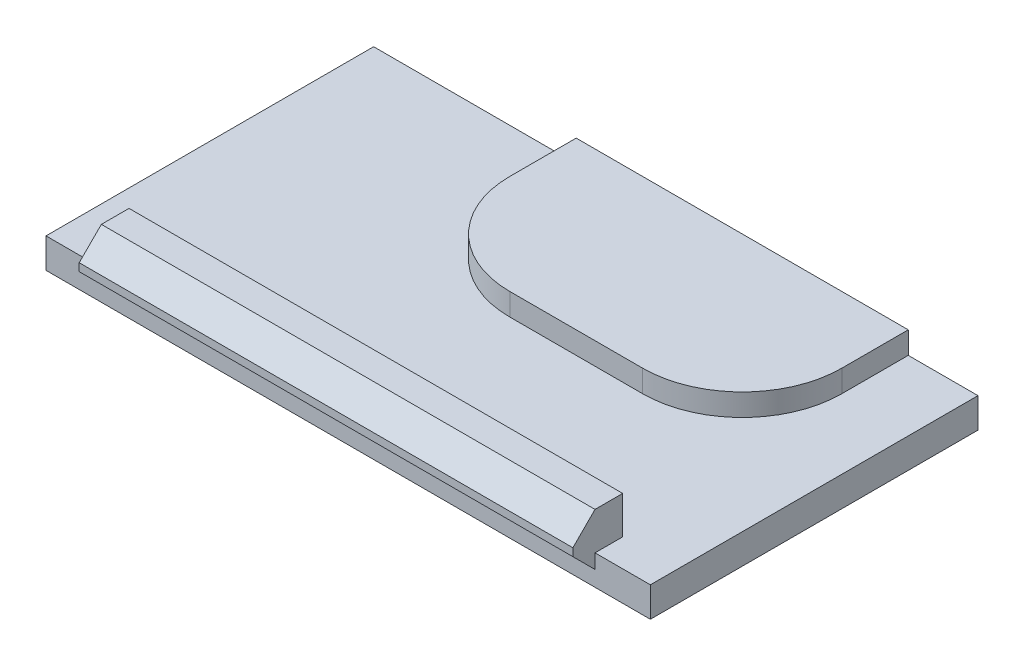
from build123d import *

# Parameters (mm, degrees)
SKETCH1_W           = 69.342
SKETCH1_H           = 37.592
BOSS_EXTRUDE1_DEPTH = 3.429
CUT_EXTRUDE1_DEPTH  = 3.429
SKETCH5_W           = 56.642
SKETCH5_H           = 6.35
BOSS_EXTRUDE3_DEPTH = 2.54
CHAMFER1_SIZE       = 2.7305
SKETCH6_W           = 56.642
SKETCH6_H           = 4.318
BOSS_EXTRUDE4_DEPTH = 3.175
CUT_EXTRUDE2_DEPTH  = 1.016
BOSS_EXTRUDE5_DEPTH = 2.54
CUT_EXTRUDE3_DEPTH  = 0.635


with BuildPart() as part:
    # Sketch1 → Boss-Extrude1 (new body)
    with BuildSketch(Plane(origin=(0, 0, 0), x_dir=(1, 0, 0), z_dir=(0, 1, 0))):
        with Locations((34.671, 18.796)):
            Rectangle(SKETCH1_W, SKETCH1_H)
    extrude(amount=BOSS_EXTRUDE1_DEPTH)

    # Sketch3 → Cut-Extrude1 (cut)
    with BuildSketch(Plane.XZ):
        with BuildLine():
            Line((34.671, -22.352), (49.911, -22.352))
            ThreePointArc((49.911, -22.352), (55.299153673, -24.583846327), (57.531, -29.972))
            Line((57.531, -29.972), (57.531, -37.592))
            Line((57.531, -37.592), (27.051, -37.592))
            Line((27.051, -37.592), (27.051, -29.972))
            ThreePointArc((27.051, -29.972), (29.282846327, -24.583846327), (34.671, -22.352))
        make_face()
    extrude(amount=-CUT_EXTRUDE1_DEPTH, mode=Mode.SUBTRACT)

    # Sketch5 → Boss-Extrude3 (add)
    with BuildSketch(Plane.XY):
        with Locations((34.671, 4.7625)):
            Rectangle(SKETCH5_W, SKETCH5_H)
    extrude(amount=BOSS_EXTRUDE3_DEPTH)

    # Chamfer1
    # the kernel refuses this chamfer: 2.7305 mm, written as the material it takes off along each edge
    with BuildSketch(Plane(origin=(-0.671980399, 1.5875, 2.54), x_dir=(0, -0.02749587661058634, -0.9996219169112968), z_dir=(1, 0, 0))) as chamfer1_piece_1_section:
        Polygon((CHAMFER1_SIZE * 0.999621916911, CHAMFER1_SIZE * 0.0274958766106), (-CHAMFER1_SIZE * 0.0274958766106, CHAMFER1_SIZE * 0.999621916911), (0, 0), align=None)
    chamfer1_piece_1 = extrude(amount=70.685960797, mode=Mode.PRIVATE)
    chamfer1_piece_1 = split(chamfer1_piece_1, bisect_by=Plane(origin=(34.671, 2.498762028, 0), z_dir=(0, 0, 1)), keep=Keep.TOP, mode=Mode.PRIVATE)
    add(chamfer1_piece_1, mode=Mode.SUBTRACT)
    with BuildSketch(Plane(origin=(70.013980399, 7.9375, 2.54), x_dir=(0, 0.02749587661058634, -0.9996219169112968), z_dir=(-1, 0, 0))) as chamfer1_piece_2:
        Polygon((CHAMFER1_SIZE * 0.999621916911, CHAMFER1_SIZE * 0.0274958766106), (-CHAMFER1_SIZE * 0.0274958766106, CHAMFER1_SIZE * 0.999621916911), (0, 0), align=None)
    extrude(amount=70.685960797, mode=Mode.SUBTRACT)

    # Sketch6 → Boss-Extrude4 (add)
    with BuildSketch(Plane(origin=(0, 0, 0), x_dir=(-1, 0, 0), z_dir=(0, 0, -1))):
        with Locations((-34.671, 5.588)):
            Rectangle(SKETCH6_W, SKETCH6_H)
    extrude(amount=BOSS_EXTRUDE4_DEPTH)

    # Sketch7 → Cut-Extrude2 (cut)
    # profile 1 of 7: a face of its own
    with BuildSketch(Plane.XZ):
        with BuildLine():
            Line((17.8435, -9.756179687), (17.8435, -11.630173828))
            Line((17.8435, -11.630173828), (19.303255859, -13.87871875))
            add(Edge.make_bspline(
                [(19.303255859, -13.87871875), (19.333082521, -13.92746022), (19.389220216, -14.01919807), (19.467229222, -14.148781061), (19.528677409, -14.264558967), (19.580016227, -14.365273157), (19.61965403, -14.455605764), (19.647893884, -14.540082133), (19.664806725, -14.620103968), (19.666892598, -14.672398842), (19.667884766, -14.697273437)],
                knots=[0, 0, 0, 0, 1.513765201, 2.849104966, 4.005400528, 4.984881254, 5.843325008, 6.615578944, 7.341485849, 8, 8, 8, 8], degree=3))
            add(Edge.make_bspline(
                [(19.667884766, -14.697273437), (19.666083256, -14.736461594), (19.662532201, -14.81370753), (19.623568591, -14.924079539), (19.564613316, -15.026549808), (19.482815159, -15.116813938), (19.385320142, -15.192772997), (19.274562965, -15.248141814), (19.153012492, -15.281347879), (19.06864655, -15.285499159), (19.025443359, -15.287625)],
                knots=[0, 0, 0, 0, 0.967290349, 1.906679347, 2.865963496, 3.881670404, 4.904070167, 5.91189522, 6.930696602, 8, 8, 8, 8], degree=3))
            add(Edge.make_bspline(
                [(19.025443359, -15.287625), (18.971900024, -15.285744756), (18.871555299, -15.282221021), (18.732350339, -15.249702391), (18.614403604, -15.197763486), (18.519289518, -15.11537032), (18.434264986, -15.008913362), (18.340894793, -14.87810551), (18.233449602, -14.720438073), (18.161331209, -14.603748541), (18.122552734, -14.541003906)],
                knots=[0, 0, 0, 0, 1.029591909, 1.929542078, 2.738104438, 3.484324936, 4.326377118, 5.358398219, 6.579595497, 8, 8, 8, 8], degree=3))
            Line((18.122552734, -14.541003906), (17.113001953, -12.747625))
            Line((17.113001953, -12.747625), (16.091048828, -14.541003906))
            add(Edge.make_bspline(
                [(16.091048828, -14.541003906), (16.059116591, -14.593035606), (16.000111051, -14.689181658), (15.918311833, -14.825652969), (15.84086654, -14.94793678), (15.756654522, -15.057702837), (15.660655736, -15.156145287), (15.564886922, -15.21728553), (15.481862471, -15.255216941), (15.41249658, -15.272630899), (15.337924337, -15.286169699), (15.285794586, -15.287129125), (15.258851562, -15.287625)],
                knots=[0, 0, 0, 0, 1.549279365, 2.862814253, 4.038509164, 5.220041374, 6.369987328, 7.507856362, 8.080983668, 8.679110618, 9.317304378, 10, 10, 10, 10], degree=3))
            add(Edge.make_bspline(
                [(15.258851562, -15.287625), (15.208598211, -15.285807264), (15.112135343, -15.282318063), (14.975120726, -15.246538871), (14.853647228, -15.187940087), (14.751868111, -15.106739169), (14.669114473, -15.014898083), (14.608673284, -14.917476898), (14.569423601, -14.817127084), (14.564341811, -14.748449449), (14.561839844, -14.714636719)],
                knots=[0, 0, 0, 0, 1.208599368, 2.319943975, 3.384643501, 4.434751949, 5.43650444, 6.348784468, 7.187040944, 8, 8, 8, 8], degree=3))
            add(Edge.make_bspline(
                [(14.561839844, -14.714636719), (14.562807099, -14.687698172), (14.564756099, -14.633417577), (14.580408671, -14.552240659), (14.605578559, -14.470836026), (14.642073882, -14.385841233), (14.693115005, -14.291259966), (14.758803917, -14.180855343), (14.839952003, -14.05079872), (14.900984395, -13.959161218), (14.933910156, -13.909724609)],
                knots=[0, 0, 0, 0, 0.718272968, 1.447304661, 2.197390998, 2.988136893, 3.910732374, 5.062720114, 6.415395981, 8, 8, 8, 8], degree=3))
            Line((14.933910156, -13.909724609), (16.41475, -11.651257812))
            Line((16.41475, -11.651257812), (16.41475, -9.756179687))
            add(Edge.make_bspline(
                [(16.41475, -9.756179687), (16.416712923, -9.695977355), (16.420467631, -9.580821446), (16.460315942, -9.418568618), (16.521542972, -9.274810734), (16.611257531, -9.153960595), (16.723146471, -9.057153172), (16.855264547, -8.985818075), (17.007647926, -8.944633687), (17.115227918, -8.940026187), (17.171292969, -8.937625)],
                knots=[0, 0, 0, 0, 1.143662758, 2.187614994, 3.159925365, 4.099461948, 5.025490777, 5.954923276, 6.934213254, 8, 8, 8, 8], degree=3))
            add(Edge.make_bspline(
                [(17.171292969, -8.937625), (17.219111004, -8.939738572), (17.311883776, -8.943839158), (17.443850911, -8.983457525), (17.561001692, -9.049794731), (17.66259808, -9.14167627), (17.746096763, -9.259126982), (17.804026489, -9.403393246), (17.838391686, -9.571837097), (17.841730831, -9.692336079), (17.8435, -9.756179687)],
                knots=[0, 0, 0, 0, 0.955720714, 1.854213775, 2.729167517, 3.631960796, 4.576135951, 5.589403894, 6.722801219, 8, 8, 8, 8], degree=3))
        make_face()
    # profile 2 of 7: a face of its own
    with BuildSketch(Plane.XZ):
        with BuildLine():
            Line((23.750736328, -11.557), (24.03475, -11.557))
            Line((24.03475, -11.557), (24.03475, -9.743777344))
            add(Edge.make_bspline(
                [(24.03475, -9.743777344), (24.036856397, -9.683616338), (24.040868096, -9.5690378), (24.078413338, -9.40745753), (24.140601109, -9.266400164), (24.228753797, -9.147704432), (24.339751878, -9.052892068), (24.471699727, -8.985049606), (24.623184886, -8.944711415), (24.730263494, -8.940060378), (24.786332031, -8.937625)],
                knots=[0, 0, 0, 0, 1.154399682, 2.198590736, 3.165524206, 4.096391948, 5.014739983, 5.945472179, 6.924207446, 8, 8, 8, 8], degree=3))
            add(Edge.make_bspline(
                [(24.786332031, -8.937625), (24.837473971, -8.940050202), (24.935264537, -8.944687528), (25.073271503, -8.985420701), (25.192873103, -9.05322188), (25.291411403, -9.149728456), (25.370700662, -9.268922502), (25.424358898, -9.413190974), (25.45814242, -9.578501062), (25.461650395, -9.696463582), (25.4635, -9.758660156)],
                knots=[0, 0, 0, 0, 1.015336208, 1.941465323, 2.83277956, 3.722461664, 4.6596921, 5.656720356, 6.764489224, 8, 8, 8, 8], degree=3))
            Line((25.4635, -9.758660156), (25.4635, -14.382253906))
            add(Edge.make_bspline(
                [(25.4635, -14.382253906), (25.46257202, -14.416575994), (25.46076903, -14.483261069), (25.453041563, -14.57962813), (25.436446858, -14.668732688), (25.414258396, -14.750947466), (25.386295003, -14.826464236), (25.351102318, -14.894934082), (25.308825829, -14.955306367), (25.261085191, -15.009982668), (25.206389983, -15.057134038), (25.143989178, -15.09748163), (25.074837592, -15.131685323), (24.998985983, -15.160654377), (24.915541301, -15.181070119), (24.825771929, -15.197669164), (24.72817607, -15.205573073), (24.661077258, -15.207336906), (24.626341797, -15.20825)],
                knots=[0, 0, 0, 0, 1.214535223, 2.359744881, 3.415267104, 4.415661951, 5.368991347, 6.25849837, 7.130646898, 7.969806146, 8.819978287, 9.675791146, 10.591361144, 11.544690539, 12.541337574, 13.625641143, 14.770850801, 16, 16, 16, 16], degree=3))
            Line((24.626341797, -15.20825), (22.617162109, -15.20825))
            add(Edge.make_bspline(
                [(22.617162109, -15.20825), (22.548528665, -15.207810611), (22.415766433, -15.206960673), (22.22220731, -15.199376253), (22.041041591, -15.187174833), (21.871624661, -15.170600248), (21.714107637, -15.145986844), (21.56813825, -15.11285772), (21.432925831, -15.07139095), (21.349351025, -15.034965083), (21.308714844, -15.017253906)],
                knots=[0, 0, 0, 0, 1.236366513, 2.391585887, 3.488891338, 4.507097013, 5.457223593, 6.358734326, 7.201975181, 8, 8, 8, 8], degree=3))
            add(Edge.make_bspline(
                [(21.308714844, -15.017253906), (21.255184326, -14.991933658), (21.14987037, -14.94211954), (21.004458637, -14.848774812), (20.870560483, -14.745733516), (20.750194022, -14.630662729), (20.645479208, -14.504726501), (20.552008483, -14.372931579), (20.475528083, -14.231753184), (20.411686037, -14.084167263), (20.364258041, -13.930452509), (20.328547839, -13.773016395), (20.309094822, -13.611729382), (20.30578645, -13.502973928), (20.304125, -13.448357422)],
                knots=[0, 0, 0, 0, 1.077917134, 2.120654199, 3.140645302, 4.15281941, 5.147123564, 6.120844735, 7.091677515, 8.066854218, 9.045950049, 10.018155156, 11.004726321, 12, 12, 12, 12], degree=3))
            add(Edge.make_bspline(
                [(20.304125, -13.448357422), (20.305260161, -13.392081842), (20.307478578, -13.282103849), (20.326460136, -13.121094544), (20.357571224, -12.968572796), (20.399088036, -12.823102945), (20.455963165, -12.686721694), (20.522119477, -12.556440906), (20.604072562, -12.436207754), (20.695619172, -12.32279061), (20.799131849, -12.218641431), (20.911979819, -12.123195312), (21.034385406, -12.036500466), (21.167610208, -11.961622142), (21.309361548, -11.894513481), (21.460366623, -11.835653118), (21.621355962, -11.787378664), (21.733096664, -11.763739308), (21.789925781, -11.751716797)],
                knots=[0, 0, 0, 0, 1.091520374, 2.133131664, 3.139820034, 4.109334877, 5.062556442, 6.002423716, 6.93893125, 7.879653681, 8.826782147, 9.782867511, 10.744153131, 11.732006354, 12.743730268, 13.784847377, 14.873417052, 16, 16, 16, 16], degree=3))
            add(Edge.make_bspline(
                [(21.789925781, -11.751716797), (21.741159478, -11.731794156), (21.639193204, -11.690137577), (21.494486289, -11.591415268), (21.348551333, -11.465468614), (21.203894615, -11.312647231), (21.063185667, -11.142702454), (20.928139406, -10.963846751), (20.799875998, -10.780011674), (20.68123935, -10.592640563), (20.574121253, -10.407215408), (20.476345163, -10.231369438), (20.393705495, -10.065609548), (20.324164914, -9.913137327), (20.270539651, -9.777349117), (20.230400125, -9.663546006), (20.203586828, -9.572582013), (20.199285019, -9.518579806), (20.197464844, -9.495730469)],
                knots=[0, 0, 0, 0, 0.88961411, 1.860108903, 2.947071614, 4.149790625, 5.416758447, 6.680630153, 7.942485308, 9.210245293, 10.433314548, 11.567095335, 12.615528594, 13.5676836, 14.403277112, 15.084937916, 15.612820237, 16, 16, 16, 16], degree=3))
            add(Edge.make_bspline(
                [(20.197464844, -9.495730469), (20.198238107, -9.475330345), (20.199828045, -9.433384828), (20.219543869, -9.371355622), (20.245173087, -9.30653422), (20.283828079, -9.242237636), (20.331814411, -9.178342198), (20.391823553, -9.120698576), (20.460865138, -9.067504516), (20.540405999, -9.022459715), (20.62835303, -8.983094279), (20.724999855, -8.956829178), (20.828553997, -8.939826191), (20.89977765, -8.938375769), (20.936644531, -8.937625)],
                knots=[0, 0, 0, 0, 0.717027304, 1.474308742, 2.278717838, 3.174222897, 4.110601243, 5.090384547, 6.099683417, 7.177866346, 8.307780278, 9.489770653, 10.700651772, 12, 12, 12, 12], degree=3))
            add(Edge.make_bspline(
                [(20.936644531, -8.937625), (20.973118963, -8.938645891), (21.043760062, -8.94062308), (21.145065969, -8.960641533), (21.237116641, -8.994358706), (21.345849155, -9.056535184), (21.465479787, -9.155103496), (21.564345439, -9.27714363), (21.636385362, -9.390684383), (21.703739123, -9.488894566), (21.774269884, -9.606755386), (21.825765686, -9.689701767), (21.853177734, -9.733855469)],
                knots=[0, 0, 0, 0, 0.852299278, 1.65067295, 2.403290245, 3.134930016, 4.571153941, 5.999904196, 6.78837883, 7.716310071, 8.784354883, 10, 10, 10, 10], degree=3))
            Line((21.853177734, -9.733855469), (22.335628906, -10.530085937))
            add(Edge.make_bspline(
                [(22.335628906, -10.530085937), (22.378958655, -10.598208448), (22.460698776, -10.726719285), (22.583397618, -10.90311567), (22.697402106, -11.053048146), (22.804742125, -11.178124937), (22.90928228, -11.280688388), (23.012388928, -11.364649282), (23.115727595, -11.431417007), (23.222039673, -11.481590361), (23.336006233, -11.517058291), (23.461892092, -11.539118835), (23.601523588, -11.554672516), (23.69942385, -11.556199606), (23.750736328, -11.557)],
                knots=[0, 0, 0, 0, 1.566026962, 2.954257469, 4.166893724, 5.218566879, 6.14863677, 7.004072542, 7.793833268, 8.529282063, 9.27751846, 10.101708809, 11.005048365, 12, 12, 12, 12], degree=3))
        make_face()
        with BuildLine():
            Line((23.025199219, -14.097), (24.03475, -14.097))
            Line((24.03475, -14.097), (24.03475, -12.588875))
            Line((24.03475, -12.588875), (23.059925781, -12.588875))
            add(Edge.make_bspline(
                [(23.059925781, -12.588875), (22.988814495, -12.590051153), (22.852679535, -12.592302772), (22.657400466, -12.603067258), (22.481264149, -12.627751092), (22.322920113, -12.656566169), (22.184258649, -12.699230807), (22.062442522, -12.750388614), (21.960506845, -12.816355336), (21.875402869, -12.893181789), (21.810026262, -12.985753655), (21.76457814, -13.094007761), (21.736737972, -13.218354799), (21.734209346, -13.306398874), (21.732875, -13.352859375)],
                knots=[0, 0, 0, 0, 1.469473603, 2.813150226, 4.036801077, 5.142342931, 6.133888202, 7.028875978, 7.862808153, 8.630418774, 9.384026326, 10.183661508, 11.041525561, 12, 12, 12, 12], degree=3))
            add(Edge.make_bspline(
                [(21.732875, -13.352859375), (21.734172808, -13.389790843), (21.73670626, -13.461884821), (21.76043203, -13.566103163), (21.795641602, -13.664335482), (21.848685234, -13.753939408), (21.914776806, -13.834579287), (21.992322374, -13.906280245), (22.082411792, -13.966468538), (22.149099801, -13.996249305), (22.183080078, -14.011423828)],
                knots=[0, 0, 0, 0, 1.041433741, 2.032984454, 3.004538253, 3.977704124, 4.956874232, 5.940142322, 6.950417966, 8, 8, 8, 8], degree=3))
            add(Edge.make_bspline(
                [(22.183080078, -14.011423828), (22.202818346, -14.018388603), (22.245832919, -14.033566572), (22.318626656, -14.050226814), (22.403943798, -14.064706219), (22.502377779, -14.077430544), (22.614223002, -14.084904763), (22.739422509, -14.093226953), (22.878011725, -14.096205012), (22.974763719, -14.096727588), (23.025199219, -14.097)],
                knots=[0, 0, 0, 0, 0.590543186, 1.286939845, 2.104370999, 3.03378788, 4.087407475, 5.268320823, 6.576012755, 8, 8, 8, 8], degree=3))
        make_face(mode=Mode.SUBTRACT)
    # profile 3 of 7: a face of its own
    with BuildSketch(Plane.XZ):
        with BuildLine():
            Line((27.239515625, -14.097), (29.829125, -14.097))
            Line((29.829125, -14.097), (29.829125, -12.827))
            Line((29.829125, -12.827), (27.457796875, -12.827))
            add(Edge.make_bspline(
                [(27.457796875, -12.827), (27.400989372, -12.825487455), (27.29425176, -12.822645481), (27.145176373, -12.791603914), (27.018490897, -12.740577814), (26.916857774, -12.666774963), (26.840255655, -12.579409889), (26.783550069, -12.484688556), (26.75000355, -12.381881502), (26.745627663, -12.310883989), (26.743421875, -12.275095703)],
                knots=[0, 0, 0, 0, 1.34356286, 2.524467446, 3.586348189, 4.553761642, 5.469251024, 6.320561262, 7.153431846, 8, 8, 8, 8], degree=3))
            add(Edge.make_bspline(
                [(26.743421875, -12.275095703), (26.745663992, -12.239317187), (26.750136652, -12.167944861), (26.783349371, -12.064835857), (26.839268252, -11.96984415), (26.913304687, -11.880224577), (27.01410281, -11.805070972), (27.140962915, -11.751350243), (27.291926281, -11.721886741), (27.400202972, -11.717880811), (27.457796875, -11.71575)],
                knots=[0, 0, 0, 0, 0.841855965, 1.679365891, 2.52105295, 3.426068634, 4.399654148, 5.450495285, 6.643882397, 8, 8, 8, 8], degree=3))
            Line((27.457796875, -11.71575), (29.829125, -11.71575))
            Line((29.829125, -11.71575), (29.829125, -10.12825))
            Line((29.829125, -10.12825), (27.145257812, -10.12825))
            add(Edge.make_bspline(
                [(27.145257812, -10.12825), (27.087583585, -10.126893099), (26.978642614, -10.124330047), (26.827351751, -10.091092372), (26.696319145, -10.04172916), (26.591520456, -9.967091589), (26.509789542, -9.879294847), (26.450415782, -9.782870038), (26.413153872, -9.678193514), (26.409276891, -9.605584254), (26.407318359, -9.568904297)],
                knots=[0, 0, 0, 0, 1.331680403, 2.515413968, 3.566868346, 4.548674152, 5.462331903, 6.325163317, 7.153924188, 8, 8, 8, 8], degree=3))
            add(Edge.make_bspline(
                [(26.407318359, -9.568904297), (26.409258367, -9.533033842), (26.413099992, -9.46200278), (26.450626735, -9.360119969), (26.509119961, -9.265244281), (26.590156465, -9.178509474), (26.694536356, -9.103157522), (26.825383713, -9.052531521), (26.978004523, -9.021345065), (27.087205987, -9.018508126), (27.145257812, -9.017)],
                knots=[0, 0, 0, 0, 0.831851676, 1.64724165, 2.49365156, 3.412615864, 4.39226731, 5.462355847, 6.650980777, 8, 8, 8, 8], degree=3))
            Line((27.145257812, -9.017), (30.449242188, -9.017))
            add(Edge.make_bspline(
                [(30.449242188, -9.017), (30.483563813, -9.017905691), (30.549424896, -9.019643657), (30.64497803, -9.027538178), (30.732622052, -9.04436589), (30.81414295, -9.064353807), (30.887862787, -9.093593452), (30.954579455, -9.127754453), (31.014483732, -9.168183663), (31.066740306, -9.215334999), (31.111844856, -9.270093144), (31.152210152, -9.330642317), (31.183496181, -9.399864213), (31.21168237, -9.474969495), (31.232120019, -9.557857078), (31.246412981, -9.647497666), (31.257358114, -9.743927526), (31.257698065, -9.810715444), (31.257875, -9.845476562)],
                knots=[0, 0, 0, 0, 1.231237759, 2.362669336, 3.432707315, 4.428711373, 5.367466922, 6.269206627, 7.112120463, 7.951768952, 8.783131882, 9.650714053, 10.552575606, 11.499953392, 12.524669123, 13.606756769, 14.754388293, 16, 16, 16, 16], degree=3))
            Line((31.257875, -9.845476562), (31.257875, -14.379773437))
            add(Edge.make_bspline(
                [(31.257875, -14.379773437), (31.257107499, -14.424886272), (31.2556374, -14.511297101), (31.239436483, -14.635217949), (31.212384161, -14.747096596), (31.175590756, -14.847633469), (31.126984499, -14.936093512), (31.065256923, -15.012250323), (30.989529791, -15.074898204), (30.901329609, -15.124261293), (30.802914728, -15.163157483), (30.693618442, -15.18758125), (30.575160183, -15.206591039), (30.492325761, -15.207682377), (30.449242188, -15.20825)],
                knots=[0, 0, 0, 0, 1.214398255, 2.32610434, 3.357647154, 4.308917227, 5.201079262, 6.063569557, 6.933145109, 7.830778671, 8.775641931, 9.772099159, 10.841231371, 12, 12, 12, 12], degree=3))
            Line((30.449242188, -15.20825), (27.239515625, -15.20825))
            add(Edge.make_bspline(
                [(27.239515625, -15.20825), (27.180639194, -15.206785475), (27.070614883, -15.204048669), (26.917099614, -15.172780959), (26.787051991, -15.122103611), (26.682663436, -15.048453962), (26.604699395, -14.960683037), (26.546818334, -14.866045317), (26.511438694, -14.762950691), (26.507360529, -14.691341505), (26.505296875, -14.655105469)],
                knots=[0, 0, 0, 0, 1.367649566, 2.555771433, 3.625407075, 4.591237532, 5.496836017, 6.33790008, 7.158935936, 8, 8, 8, 8], degree=3))
            add(Edge.make_bspline(
                [(26.505296875, -14.655105469), (26.507318298, -14.618037237), (26.511290569, -14.545194952), (26.546835442, -14.440532688), (26.604296554, -14.34472849), (26.682712157, -14.256827185), (26.787037032, -14.183136826), (26.917104268, -14.132472017), (27.070613454, -14.101200417), (27.180638696, -14.098464206), (27.239515625, -14.097)],
                knots=[0, 0, 0, 0, 0.856287399, 1.682678897, 2.528143478, 3.429626615, 4.391068009, 5.455842863, 6.638565499, 8, 8, 8, 8], degree=3))
        make_face()
    # profile 4 of 7: a face of its own
    with BuildSketch(Plane.XZ):
        with BuildLine():
            Line((32.703988281, -14.017625), (33.87725, -14.017625))
            Line((33.87725, -14.017625), (33.87725, -9.754939453))
            add(Edge.make_bspline(
                [(33.87725, -9.754939453), (33.879367052, -9.694360912), (33.883414172, -9.578554332), (33.921007406, -9.415615604), (33.981885436, -9.27214702), (34.0700314, -9.151734135), (34.179953097, -9.054276617), (34.312604892, -8.986171666), (34.463859624, -8.944477129), (34.571496895, -8.93997255), (34.627591797, -8.937625)],
                knots=[0, 0, 0, 0, 1.154629349, 2.207277943, 3.171820454, 4.109229712, 5.031812441, 5.949388451, 6.931328794, 8, 8, 8, 8], degree=3))
            add(Edge.make_bspline(
                [(34.627591797, -8.937625), (34.675868293, -8.939595502), (34.769658836, -8.943423752), (34.902286349, -8.985094442), (35.02095692, -9.050475124), (35.122441093, -9.143371341), (35.207688703, -9.259876419), (35.264632423, -9.404503954), (35.301430823, -9.571602601), (35.304417968, -9.691460905), (35.306, -9.754939453)],
                knots=[0, 0, 0, 0, 0.962049416, 1.86904903, 2.749462988, 3.650458293, 4.597559148, 5.608809099, 6.733593565, 8, 8, 8, 8], degree=3))
            Line((35.306, -9.754939453), (35.306, -14.017625))
            Line((35.306, -14.017625), (36.557396484, -14.017625))
            add(Edge.make_bspline(
                [(36.557396484, -14.017625), (36.611316749, -14.019182206), (36.713553169, -14.022134773), (36.856292812, -14.053188975), (36.979280702, -14.103535767), (37.078933323, -14.177115287), (37.156756852, -14.266560526), (37.214639807, -14.369099985), (37.24693021, -14.486189086), (37.251041697, -14.56809768), (37.253167969, -14.610457031)],
                knots=[0, 0, 0, 0, 1.248957996, 2.368107735, 3.369114878, 4.308908267, 5.21279168, 6.101336099, 7.018098511, 8, 8, 8, 8], degree=3))
            add(Edge.make_bspline(
                [(37.253167969, -14.610457031), (37.251382256, -14.654555854), (37.247950151, -14.739312945), (37.21152918, -14.858909404), (37.15421255, -14.964205495), (37.072680604, -15.052765332), (36.970211314, -15.122545535), (36.849034577, -15.173900631), (36.708843308, -15.203266663), (36.609628569, -15.20653131), (36.557396484, -15.20825)],
                knots=[0, 0, 0, 0, 1.016926431, 1.954513078, 2.861635154, 3.768303807, 4.709635271, 5.707513053, 6.793109035, 8, 8, 8, 8], degree=3))
            Line((36.557396484, -15.20825), (32.703988281, -15.20825))
            add(Edge.make_bspline(
                [(32.703988281, -15.20825), (32.641377935, -15.206465536), (32.524217053, -15.203126322), (32.36100339, -15.169582226), (32.222335269, -15.114833745), (32.111483981, -15.035321659), (32.027418714, -14.940795899), (31.966916498, -14.837912184), (31.928336525, -14.726793127), (31.923735693, -14.649625823), (31.921400391, -14.610457031)],
                knots=[0, 0, 0, 0, 1.358133897, 2.541435648, 3.600193662, 4.571887994, 5.47482421, 6.327907378, 7.151274642, 8, 8, 8, 8], degree=3))
            add(Edge.make_bspline(
                [(31.921400391, -14.610457031), (31.923767756, -14.571304411), (31.928431756, -14.494168967), (31.966496153, -14.382951412), (32.028878266, -14.280894359), (32.115346157, -14.188254991), (32.227170829, -14.110654771), (32.364794733, -14.054306367), (32.526941383, -14.02355845), (32.642673543, -14.019679868), (32.703988281, -14.017625)],
                knots=[0, 0, 0, 0, 0.852185429, 1.678909384, 2.532333663, 3.444447146, 4.422266187, 5.477013398, 6.663325204, 8, 8, 8, 8], degree=3))
        make_face()
    # profile 5 of 7: a face of its own
    with BuildSketch(Plane.XZ):
        with BuildLine():
            Line((38.180863281, -14.017625), (39.354125, -14.017625))
            Line((39.354125, -14.017625), (39.354125, -9.754939453))
            add(Edge.make_bspline(
                [(39.354125, -9.754939453), (39.356242052, -9.694360912), (39.360289172, -9.578554332), (39.397882406, -9.415615604), (39.458760436, -9.27214702), (39.5469064, -9.151734135), (39.656828097, -9.054276617), (39.789479892, -8.986171666), (39.940734624, -8.944477129), (40.048371895, -8.93997255), (40.104466797, -8.937625)],
                knots=[0, 0, 0, 0, 1.154629349, 2.207277943, 3.171820454, 4.109229712, 5.031812441, 5.949388451, 6.931328794, 8, 8, 8, 8], degree=3))
            add(Edge.make_bspline(
                [(40.104466797, -8.937625), (40.152743293, -8.939595502), (40.246533836, -8.943423752), (40.379161349, -8.985094442), (40.49783192, -9.050475124), (40.599316093, -9.143371341), (40.684563703, -9.259876419), (40.741507423, -9.404503954), (40.778305823, -9.571602601), (40.781292968, -9.691460905), (40.782875, -9.754939453)],
                knots=[0, 0, 0, 0, 0.962049416, 1.86904903, 2.749462988, 3.650458293, 4.597559148, 5.608809099, 6.733593565, 8, 8, 8, 8], degree=3))
            Line((40.782875, -9.754939453), (40.782875, -14.017625))
            Line((40.782875, -14.017625), (42.034271484, -14.017625))
            add(Edge.make_bspline(
                [(42.034271484, -14.017625), (42.088191749, -14.019182206), (42.190428169, -14.022134773), (42.333167812, -14.053188975), (42.456155702, -14.103535767), (42.555808323, -14.177115287), (42.633631852, -14.266560526), (42.691514807, -14.369099985), (42.72380521, -14.486189086), (42.727916697, -14.56809768), (42.730042969, -14.610457031)],
                knots=[0, 0, 0, 0, 1.248957996, 2.368107735, 3.369114878, 4.308908267, 5.21279168, 6.101336099, 7.018098511, 8, 8, 8, 8], degree=3))
            add(Edge.make_bspline(
                [(42.730042969, -14.610457031), (42.728257256, -14.654555854), (42.724825151, -14.739312945), (42.68840418, -14.858909404), (42.63108755, -14.964205495), (42.549555604, -15.052765332), (42.447086314, -15.122545535), (42.325909577, -15.173900631), (42.185718308, -15.203266663), (42.086503569, -15.20653131), (42.034271484, -15.20825)],
                knots=[0, 0, 0, 0, 1.016926431, 1.954513078, 2.861635154, 3.768303807, 4.709635271, 5.707513053, 6.793109035, 8, 8, 8, 8], degree=3))
            Line((42.034271484, -15.20825), (38.180863281, -15.20825))
            add(Edge.make_bspline(
                [(38.180863281, -15.20825), (38.118252935, -15.206465536), (38.001092053, -15.203126322), (37.83787839, -15.169582226), (37.699210269, -15.114833745), (37.588358981, -15.035321659), (37.504293714, -14.940795899), (37.443791498, -14.837912184), (37.405211525, -14.726793127), (37.400610693, -14.649625823), (37.398275391, -14.610457031)],
                knots=[0, 0, 0, 0, 1.358133897, 2.541435648, 3.600193662, 4.571887994, 5.47482421, 6.327907378, 7.151274642, 8, 8, 8, 8], degree=3))
            add(Edge.make_bspline(
                [(37.398275391, -14.610457031), (37.400642756, -14.571304411), (37.405306756, -14.494168967), (37.443371153, -14.382951412), (37.505753266, -14.280894359), (37.592221157, -14.188254991), (37.704045829, -14.110654771), (37.841669733, -14.054306367), (38.003816383, -14.02355845), (38.119548543, -14.019679868), (38.180863281, -14.017625)],
                knots=[0, 0, 0, 0, 0.852185429, 1.678909384, 2.532333663, 3.444447146, 4.422266187, 5.477013398, 6.663325204, 8, 8, 8, 8], degree=3))
        make_face()
    # profile 6 of 7: a face of its own
    with BuildSketch(Plane.XZ):
        with BuildLine():
            Line((44.61271875, -9.754939453), (44.880609375, -10.44575))
            Line((44.880609375, -10.44575), (47.132875, -10.44575))
            Line((47.132875, -10.44575), (47.399525391, -9.740056641))
            add(Edge.make_bspline(
                [(47.399525391, -9.740056641), (47.425374064, -9.674080994), (47.473626754, -9.550921777), (47.550027022, -9.382227219), (47.625666356, -9.243584738), (47.6982344, -9.127343326), (47.789964696, -9.037316717), (47.909481751, -8.977401356), (48.055876284, -8.943997634), (48.162080696, -8.939856755), (48.219320313, -8.937625)],
                knots=[0, 0, 0, 0, 1.356495851, 2.532221723, 3.54157171, 4.380081086, 5.146955799, 5.968218826, 6.904957208, 8, 8, 8, 8], degree=3))
            add(Edge.make_bspline(
                [(48.219320313, -8.937625), (48.262139588, -8.940106406), (48.346336422, -8.944985668), (48.468595713, -8.981090595), (48.581726863, -9.041886671), (48.682599083, -9.124685574), (48.769223719, -9.220512631), (48.832744558, -9.327884921), (48.872258516, -9.443429566), (48.876822821, -9.523537767), (48.879125, -9.563943359)],
                knots=[0, 0, 0, 0, 1.022508977, 2.010590255, 3.018433159, 4.072396814, 5.115325847, 6.089726296, 7.036481419, 8, 8, 8, 8], degree=3))
            add(Edge.make_bspline(
                [(48.879125, -9.563943359), (48.876908126, -9.610435666), (48.872441956, -9.704100263), (48.843301125, -9.820971037), (48.809488593, -9.919273621), (48.77908534, -10.006093274), (48.739854387, -10.103467987), (48.712485249, -10.172472364), (48.698050781, -10.208865234)],
                knots=[0, 0, 0, 0, 1.240391658, 2.498924934, 3.197114154, 4.017672156, 4.954521381, 6, 6, 6, 6], degree=3))
            Line((48.698050781, -10.208865234), (47.166361328, -14.097))
            add(Edge.make_bspline(
                [(47.166361328, -14.097), (47.154792416, -14.126354729), (47.13035965, -14.188349949), (47.09182518, -14.285721036), (47.051441418, -14.392915742), (47.006443571, -14.505399831), (46.960049459, -14.618157355), (46.910248253, -14.724243902), (46.858620399, -14.821067313), (46.803305, -14.909031542), (46.744228724, -14.990398371), (46.673065715, -15.061389482), (46.593574451, -15.126292494), (46.503980586, -15.183341097), (46.404825318, -15.231810011), (46.293372943, -15.262571189), (46.173431011, -15.285137967), (46.089542138, -15.286780741), (46.046429688, -15.287625)],
                knots=[0, 0, 0, 0, 0.85384085, 1.803254612, 2.833770963, 3.953516855, 5.081725545, 6.132685869, 7.123765296, 8.048740288, 8.943731871, 9.83767402, 10.760210228, 11.716061658, 12.706888484, 13.733450072, 14.835167079, 16, 16, 16, 16], degree=3))
            add(Edge.make_bspline(
                [(46.046429688, -15.287625), (45.996716915, -15.286349844), (45.900885633, -15.283891728), (45.764037312, -15.26091706), (45.638592877, -15.225879596), (45.527529981, -15.1726589), (45.427665679, -15.110940158), (45.341468507, -15.040553974), (45.263496542, -14.96784861), (45.182389221, -14.860879199), (45.099495167, -14.725063128), (45.03222478, -14.584612733), (44.98584024, -14.468480143), (44.949140251, -14.373035525), (44.907317615, -14.26853333), (44.880027687, -14.195043275), (44.865726563, -14.15653125)],
                knots=[0, 0, 0, 0, 1.173104242, 2.261392367, 3.268613422, 4.238318569, 5.159421516, 6.034673558, 6.863263634, 7.669934386, 9.195474894, 10.614738013, 11.341787452, 12.148635449, 13.029803441, 14, 14, 14, 14], degree=3))
            Line((44.865726563, -14.15653125), (43.280707031, -10.243591797))
            add(Edge.make_bspline(
                [(43.280707031, -10.243591797), (43.265280029, -10.205609859), (43.235868616, -10.133197701), (43.195664566, -10.02835655), (43.162053726, -9.931997548), (43.135277979, -9.843651691), (43.111409752, -9.764362993), (43.097846931, -9.692725979), (43.085847115, -9.630066459), (43.085098331, -9.590862525), (43.08475, -9.572625)],
                knots=[0, 0, 0, 0, 1.400797675, 2.670605717, 3.83661387, 4.886636198, 5.825804719, 6.662490108, 7.377795342, 8, 8, 8, 8], degree=3))
            add(Edge.make_bspline(
                [(43.08475, -9.572625), (43.087609952, -9.535919612), (43.093417952, -9.461378186), (43.135074585, -9.351306062), (43.202378767, -9.244679428), (43.292134331, -9.142101368), (43.401256759, -9.0490171), (43.533457765, -8.985479521), (43.679514936, -8.943014814), (43.782674857, -8.9394692), (43.836332031, -8.937625)],
                knots=[0, 0, 0, 0, 0.811800447, 1.648607098, 2.573318957, 3.592022761, 4.658584099, 5.722943422, 6.815621212, 8, 8, 8, 8], degree=3))
            add(Edge.make_bspline(
                [(43.836332031, -8.937625), (43.862812364, -8.938417089), (43.913491131, -8.939933009), (43.986980996, -8.949316828), (44.053811227, -8.968302676), (44.135091329, -9.001248344), (44.226135835, -9.058386624), (44.300495855, -9.136442471), (44.355117246, -9.208286466), (44.393744843, -9.275039257), (44.435089934, -9.350319866), (44.487069984, -9.461498863), (44.546770484, -9.597220984), (44.591776496, -9.704855039), (44.61271875, -9.754939453)],
                knots=[0, 0, 0, 0, 0.784074222, 1.500582153, 2.186440713, 2.834115736, 4.093709725, 5.331172814, 6.004247542, 6.761899944, 7.610636941, 8.546642715, 10.39307941, 12, 12, 12, 12], degree=3))
        make_face()
        Polygon((46.781888672, -11.557), (45.230355469, -11.557), (46.016664063, -13.858875), align=None, mode=Mode.SUBTRACT)
    # profile 7 of 7: a face of its own
    with BuildSketch(Plane.XZ):
        with BuildLine():
            Line((52.072728516, -9.017), (53.928119141, -9.017))
            add(Edge.make_bspline(
                [(53.928119141, -9.017), (53.963268817, -9.017912223), (54.031194604, -9.019675069), (54.129605871, -9.027565826), (54.220364758, -9.04399392), (54.303615419, -9.065710632), (54.379087471, -9.094828035), (54.447425893, -9.128853828), (54.507738288, -9.170412685), (54.578686119, -9.234202211), (54.650681323, -9.335470217), (54.711444753, -9.481507421), (54.746684325, -9.654913886), (54.750720612, -9.779159725), (54.752875, -9.845476562)],
                knots=[0, 0, 0, 0, 0.936955413, 1.810640645, 2.627471322, 3.391725116, 4.099592845, 4.779477373, 5.421161952, 6.045107732, 7.31426143, 8.691323709, 10.233977494, 12, 12, 12, 12], degree=3))
            Line((54.752875, -9.845476562), (54.752875, -14.379773437))
            add(Edge.make_bspline(
                [(54.752875, -14.379773437), (54.751931703, -14.414504706), (54.750098348, -14.482006989), (54.74257189, -14.579663802), (54.725294596, -14.66970889), (54.705732586, -14.752965185), (54.676328921, -14.828326866), (54.641735074, -14.896386756), (54.602135268, -14.958470378), (54.55456189, -15.012116095), (54.499995146, -15.058105509), (54.440358311, -15.100358373), (54.371544292, -15.132927411), (54.296269878, -15.16017524), (54.214752636, -15.182972399), (54.125256654, -15.196841432), (54.029254596, -15.207654631), (53.962467377, -15.208047797), (53.928119141, -15.20825)],
                knots=[0, 0, 0, 0, 1.23433839, 2.399009964, 3.473436622, 4.488518854, 5.432146367, 6.338470699, 7.197896606, 8.040598594, 8.873648795, 9.729050444, 10.628807554, 11.567278907, 12.571897195, 13.629329402, 14.780779398, 16, 16, 16, 16], degree=3))
            Line((53.928119141, -15.20825), (51.959867188, -15.20825))
            add(Edge.make_bspline(
                [(51.959867188, -15.20825), (51.886269882, -15.207535249), (51.743533038, -15.206149038), (51.535720265, -15.195489297), (51.341400371, -15.174919192), (51.159177121, -15.150405649), (50.989621803, -15.113646907), (50.832684731, -15.063342543), (50.68596837, -15.003730234), (50.596338181, -14.952127681), (50.552201172, -14.926716797)],
                knots=[0, 0, 0, 0, 1.21522998, 2.356853829, 3.434112685, 4.440989419, 5.391666201, 6.294063564, 7.159937809, 8, 8, 8, 8], degree=3))
            add(Edge.make_bspline(
                [(50.552201172, -14.926716797), (50.510770147, -14.900144888), (50.428933366, -14.847658628), (50.317315656, -14.758249724), (50.214925842, -14.66451406), (50.124768732, -14.564141138), (50.045249151, -14.458636198), (49.976414571, -14.348622655), (49.918281602, -14.234354296), (49.869414915, -14.116385215), (49.832386901, -13.995028907), (49.806565853, -13.871294684), (49.789442065, -13.745667495), (49.787801717, -13.660907105), (49.786976563, -13.618269531)],
                knots=[0, 0, 0, 0, 1.116135352, 2.204650374, 3.240178347, 4.263052431, 5.261151483, 6.234613334, 7.20372652, 8.167056622, 9.128466554, 10.077810606, 11.03306848, 12, 12, 12, 12], degree=3))
            add(Edge.make_bspline(
                [(49.786976563, -13.618269531), (49.789426964, -13.544066489), (49.79418991, -13.399834984), (49.835953473, -13.192078849), (49.90404809, -13.000939566), (50.001022376, -12.827896529), (50.124116334, -12.671266621), (50.276599922, -12.534870365), (50.454940155, -12.413590944), (50.588400048, -12.350978712), (50.657621094, -12.318503906)],
                knots=[0, 0, 0, 0, 1.065945709, 2.071922532, 3.032704749, 3.971993065, 4.911413015, 5.883381948, 6.90218317, 8, 8, 8, 8], degree=3))
            add(Edge.make_bspline(
                [(50.657621094, -12.318503906), (50.611087013, -12.303437103), (50.520274125, -12.274033707), (50.390772681, -12.220054512), (50.269981153, -12.160776455), (50.158431877, -12.09470474), (50.054340076, -12.024175995), (49.960074254, -11.946089263), (49.875624669, -11.861213368), (49.79905056, -11.771006607), (49.730799314, -11.675273646), (49.673590654, -11.571548293), (49.623672184, -11.463234949), (49.584543014, -11.347794047), (49.551392336, -11.227136914), (49.52962858, -11.099609942), (49.517470458, -10.966059581), (49.515255639, -10.875309349), (49.514125, -10.828982422)],
                knots=[0, 0, 0, 0, 1.152824926, 2.249778238, 3.304698461, 4.322769345, 5.30420468, 6.266429307, 7.203795868, 8.123615148, 9.053910599, 9.970366726, 10.912585951, 11.862037668, 12.84090424, 13.860094396, 14.907603334, 16, 16, 16, 16], degree=3))
            add(Edge.make_bspline(
                [(49.514125, -10.828982422), (49.517004656, -10.745620792), (49.522702227, -10.580684814), (49.574833923, -10.339637164), (49.655659607, -10.108612661), (49.750206991, -9.926560649), (49.843152222, -9.790469332), (49.917839648, -9.691381587), (50.003611669, -9.601569504), (50.093382008, -9.515122546), (50.19229457, -9.437020836), (50.297990854, -9.364974192), (50.411024011, -9.298791463), (50.490723151, -9.26075865), (50.531117188, -9.241482422)],
                knots=[0, 0, 0, 0, 1.501367855, 2.970546243, 4.42513016, 5.905441488, 6.651764443, 7.395738648, 8.139376712, 8.888115259, 9.641293006, 10.408322534, 11.193287696, 12, 12, 12, 12], degree=3))
            add(Edge.make_bspline(
                [(50.531117188, -9.241482422), (50.579613701, -9.222059757), (50.679383966, -9.182102155), (50.839165955, -9.136429489), (51.010648656, -9.095764659), (51.19613473, -9.067073042), (51.395274636, -9.045573946), (51.608161545, -9.027158225), (51.835793646, -9.019815298), (51.99211201, -9.017957898), (52.072728516, -9.017)],
                knots=[0, 0, 0, 0, 0.799218745, 1.644206168, 2.540707581, 3.495803948, 4.514747062, 5.606844225, 6.76580173, 8, 8, 8, 8], degree=3))
        make_face()
        with BuildLine():
            Line((52.176908203, -11.71575), (53.324125, -11.71575))
            Line((53.324125, -11.71575), (53.324125, -10.12825))
            Line((53.324125, -10.12825), (52.134740234, -10.12825))
            add(Edge.make_bspline(
                [(52.134740234, -10.12825), (52.086775092, -10.129157176), (51.993661505, -10.130918256), (51.858199722, -10.138967446), (51.732246462, -10.154825035), (51.615702244, -10.177897312), (51.507767511, -10.203864774), (51.409466474, -10.238807684), (51.320695529, -10.280019839), (51.240337477, -10.32654795), (51.171046292, -10.382057507), (51.109177641, -10.441348316), (51.057655456, -10.508354254), (51.015579439, -10.581366171), (50.982924656, -10.661088881), (50.959530953, -10.746422025), (50.945773876, -10.838463015), (50.943863269, -10.901695237), (50.942875, -10.934402344)],
                knots=[0, 0, 0, 0, 1.41010378, 2.737400801, 3.98693174, 5.138041488, 6.228544193, 7.247067713, 8.198500548, 9.102988487, 9.968429595, 10.801972025, 11.616246964, 12.443743998, 13.271954545, 14.14165097, 15.038761902, 16, 16, 16, 16], degree=3))
            add(Edge.make_bspline(
                [(50.942875, -10.934402344), (50.943875603, -10.967112264), (50.945822567, -11.030758889), (50.959541306, -11.123161478), (50.982299286, -11.208996598), (51.017289085, -11.287054996), (51.05830026, -11.359628385), (51.111997096, -11.423265459), (51.173298974, -11.481082868), (51.244424491, -11.532339444), (51.326430242, -11.575121484), (51.417158497, -11.614514361), (51.519563902, -11.644235143), (51.631339337, -11.670316781), (51.753041244, -11.691433354), (51.885152136, -11.706005921), (52.027546972, -11.714713306), (52.126045654, -11.715396971), (52.176908203, -11.71575)],
                knots=[0, 0, 0, 0, 0.944861917, 1.838502578, 2.693382377, 3.501148934, 4.304220936, 5.093403336, 5.896208788, 6.734912813, 7.61674007, 8.564090356, 9.588089023, 10.692014175, 11.880103988, 13.154359142, 14.530573784, 16, 16, 16, 16], degree=3))
        make_face(mode=Mode.SUBTRACT)
        with BuildLine():
            Line((53.324125, -14.097), (53.324125, -12.747625))
            Line((53.324125, -12.747625), (52.333177734, -12.747625))
            add(Edge.make_bspline(
                [(52.333177734, -12.747625), (52.26122857, -12.748601436), (52.127104136, -12.750421665), (51.939242695, -12.762874924), (51.779929056, -12.78712003), (51.645325134, -12.819833715), (51.531309209, -12.866378341), (51.434186955, -12.930917583), (51.350487517, -13.012517622), (51.307987254, -13.07785655), (51.286419922, -13.111013672)],
                knots=[0, 0, 0, 0, 1.482345214, 2.763322064, 3.875138064, 4.798513303, 5.61156108, 6.398171866, 7.18713068, 8, 8, 8, 8], degree=3))
            add(Edge.make_bspline(
                [(51.286419922, -13.111013672), (51.270569043, -13.136584267), (51.239300718, -13.187026243), (51.209588917, -13.27032597), (51.187585865, -13.355852047), (51.185686085, -13.414721788), (51.184720703, -13.444636719)],
                knots=[0, 0, 0, 0, 1.017794351, 2.007757706, 2.987632891, 4, 4, 4, 4], degree=3))
            add(Edge.make_bspline(
                [(51.184720703, -13.444636719), (51.185722425, -13.475690848), (51.187656044, -13.535634489), (51.201001291, -13.621608919), (51.224300783, -13.6995474), (51.258688941, -13.769230903), (51.301967567, -13.831318649), (51.354814482, -13.885893128), (51.418002956, -13.930412459), (51.490180202, -13.96820388), (51.572907536, -13.99884561), (51.666632237, -14.023854218), (51.770901138, -14.048738435), (51.887365344, -14.064000658), (52.014516717, -14.080162015), (52.153248736, -14.089009584), (52.303349865, -14.095487796), (52.407169694, -14.096484145), (52.460921875, -14.097)],
                knots=[0, 0, 0, 0, 0.914549508, 1.765350638, 2.554959785, 3.301024164, 4.044201247, 4.776120466, 5.526346745, 6.310680468, 7.170064819, 8.118440423, 9.167121207, 10.324355074, 11.574942999, 12.942206658, 14.416843266, 16, 16, 16, 16], degree=3))
            Line((52.460921875, -14.097), (53.324125, -14.097))
        make_face(mode=Mode.SUBTRACT)
    extrude(amount=-CUT_EXTRUDE2_DEPTH, mode=Mode.SUBTRACT)

    # Sketch8 → Boss-Extrude5 (add)
    with BuildSketch(Plane(origin=(0, 3.429, 0), x_dir=(1, 0, 0), z_dir=(0, 1, 0))):
        with BuildLine():
            Line((61.341, 29.972), (61.341, 37.592))
            Line((61.341, 37.592), (57.531, 37.592))
            Line((57.531, 37.592), (57.531, 29.972))
            ThreePointArc((57.531, 29.972), (55.299153673, 24.583846327), (49.911, 22.352))
            Line((49.911, 22.352), (34.671, 22.352))
            ThreePointArc((34.671, 22.352), (29.282846327, 24.583846327), (27.051, 29.972))
            Line((27.051, 29.972), (27.051, 37.592))
            Line((27.051, 37.592), (23.241, 37.592))
            Line((23.241, 37.592), (23.241, 29.972))
            ThreePointArc((23.241, 29.972), (26.588769491, 21.889769491), (34.671, 18.542))
            Line((34.671, 18.542), (49.911, 18.542))
            ThreePointArc((49.911, 18.542), (57.993230509, 21.889769491), (61.341, 29.972))
        make_face()
        with BuildLine():
            Line((57.531, 29.972), (57.531, 37.592))
            Line((57.531, 37.592), (27.051, 37.592))
            Line((27.051, 37.592), (27.051, 29.972))
            ThreePointArc((27.051, 29.972), (29.282846327, 24.583846327), (34.671, 22.352))
            Line((34.671, 22.352), (49.911, 22.352))
            ThreePointArc((49.911, 22.352), (55.299153673, 24.583846327), (57.531, 29.972))
        make_face()
    extrude(amount=BOSS_EXTRUDE5_DEPTH)

    # Sketch9 → Cut-Extrude3 (cut)
    with BuildSketch(Plane.XZ.offset(-3.429)):
        with BuildLine():
            Line((27.051, -37.592), (57.531, -37.592))
            Line((57.531, -37.592), (57.531, -29.972))
            ThreePointArc((57.531, -29.972), (55.299153673, -24.583846327), (49.911, -22.352))
            Line((49.911, -22.352), (34.671, -22.352))
            ThreePointArc((34.671, -22.352), (29.282846327, -24.583846327), (27.051, -29.972))
            Line((27.051, -29.972), (27.051, -37.592))
        make_face()
    extrude(amount=-CUT_EXTRUDE3_DEPTH, mode=Mode.SUBTRACT)


solid = part.part
